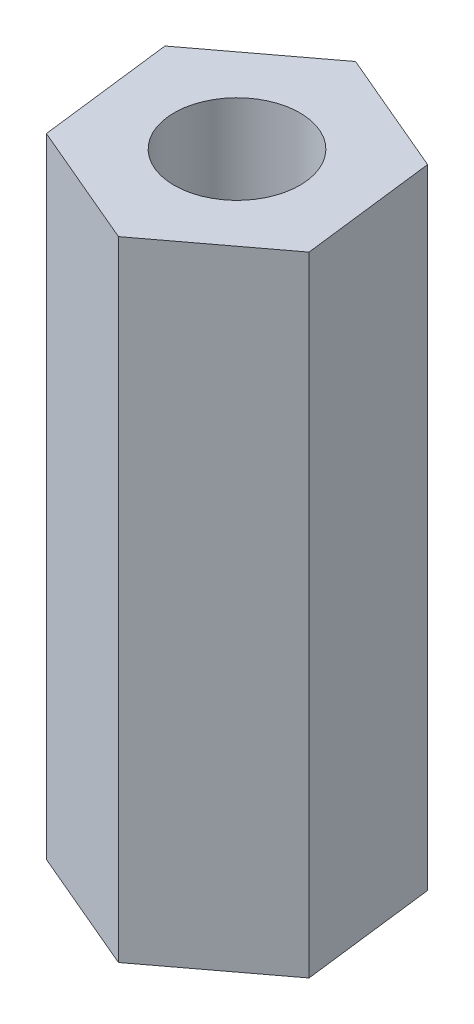
from build123d import *

# Parameters (mm, degrees)
SKETCH_1_R      = 1.6
EXTRUDE_1_DEPTH = 16


with BuildPart() as part:
    # 草图1 → 凸台-拉伸1 (new body)
    with BuildSketch(Plane(origin=(0, 0, 0), x_dir=(1, 0, 0), z_dir=(0, 1, 0))):
        Polygon((2.767176381, 2.083922954), (-0.421142027, 3.438406519), (-3.188318408, 1.354483566), (-2.767176381, -2.083922954), (0.421142027, -3.438406519), (3.188318408, -1.354483566), align=None)
        Circle(SKETCH_1_R, mode=Mode.SUBTRACT)
    extrude(amount=EXTRUDE_1_DEPTH)


solid = part.part
